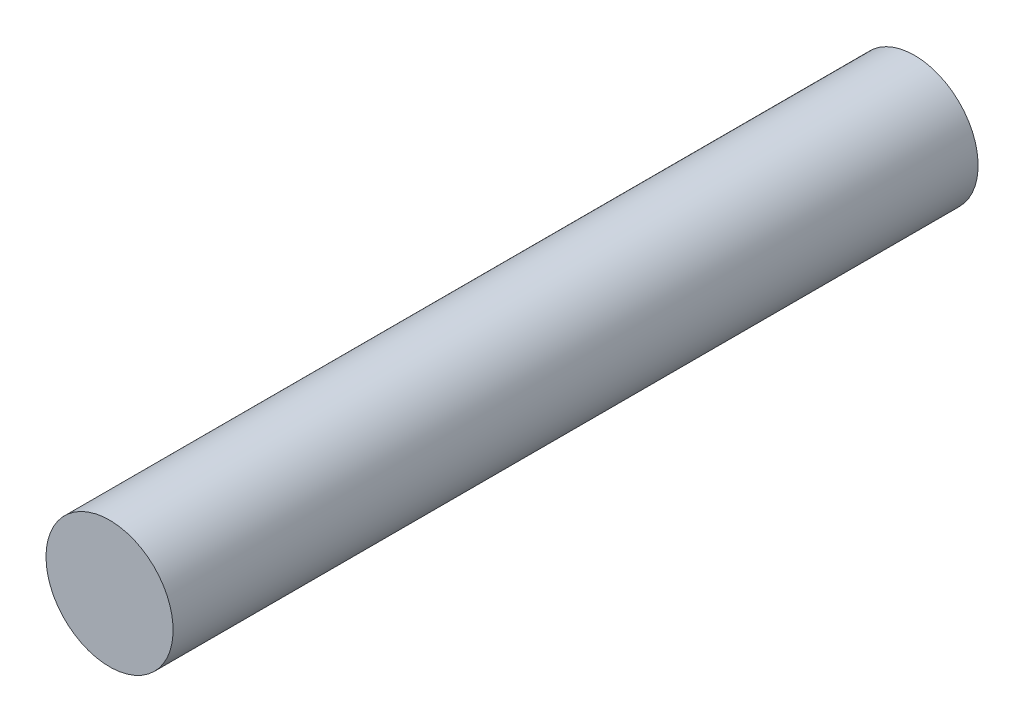
from build123d import *

# Parameters (mm, degrees)
SKETCH1_R           = 9.525
BOSS_EXTRUDE2_DEPTH = 120.65


with BuildPart() as part:
    # Sketch1 → Boss-Extrude2 (new body)
    with BuildSketch(Plane.XY):
        Circle(SKETCH1_R)
    extrude(amount=BOSS_EXTRUDE2_DEPTH)


solid = part.part
